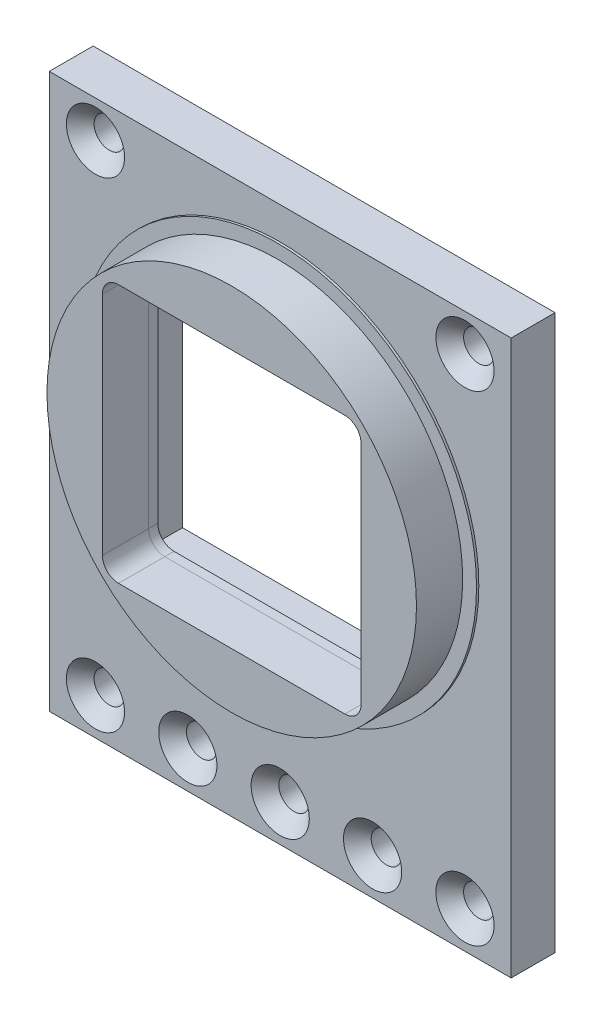
from build123d import *

# Parameters (mm, degrees)
ESQUISSE1_W                                 = 100
ESQUISSE1_H                                 = 100
ESQUISSE1_W_2                               = 56
ESQUISSE1_H_2                               = 56
BOSS_EXTRU_1_DEPTH                          = 10
CONG_1_R                                    = 3.5
BOSS_EXTRU_2_START                          = 10
ESQUISSE3_R                                 = 40
BOSS_EXTRU_2_DEPTH                          = 10
ESQUISSE4_OUTSIDE_W                         = 130.566
ESQUISSE4_OUTSIDE_H                         = 130.566
ESQUISSE4_OUTSIDE_R                         = 43
ENL_V_MAT_EXTRU_2_DEPTH                     = 0.5
ESQUISSE5_W                                 = 61.3
ESQUISSE5_H                                 = 61.3
ENL_V_MAT_EXTRU_3_DEPTH                     = 9
ESQUISSE6_W                                 = 61.3
ESQUISSE6_H                                 = 61.3
BOSS_EXTRU_3_DEPTH                          = 1
ESQUISSE12_W                                = 100
ESQUISSE12_H                                = 9.5
BOSS_EXTRU_5_DEPTH                          = 20
FRAISAGE_POUR_VIS_T_TE_FRAIS_E_M61_AT_COUNT = 2
FRAISAGE_POUR_VIS_T_TE_FRAIS_E_M61_AT_PITCH = 20
FRAISAGE_POUR_VIS_T_TE_FRAIS_E_M61_2_COUNT  = 2
FRAISAGE_POUR_VIS_T_TE_FRAIS_E_M61_2_PITCH  = 40
FRAISAGE_POUR_VIS_T_TE_FRAIS_E_M61_3_COUNT  = 2
FRAISAGE_POUR_VIS_T_TE_FRAIS_E_M61_3_PITCH  = 60
FRAISAGE_POUR_VIS_T_TE_FRAIS_E_M61_4_COUNT  = 2
FRAISAGE_POUR_VIS_T_TE_FRAIS_E_M61_4_PITCH  = 80
FRAISAGE_POUR_VIS_T_TE_FRAIS_E_M61_5_COUNT  = 2
FRAISAGE_POUR_VIS_T_TE_FRAIS_E_M61_5_PITCH  = 104
FRAISAGE_POUR_VIS_T_TE_FRAIS_E_M61_6_COUNT  = 2
FRAISAGE_POUR_VIS_T_TE_FRAIS_E_M61_6_PITCH  = 131.209755735


with BuildPart() as part:
    # Esquisse1 → Boss.-Extru.1 (new body)
    with BuildSketch(Plane.XY):
        Rectangle(ESQUISSE1_W, ESQUISSE1_H)
        Rectangle(ESQUISSE1_W_2, ESQUISSE1_H_2, mode=Mode.SUBTRACT)
    extrude(amount=BOSS_EXTRU_1_DEPTH)

    # Congé1
    cong_1_edges = [part.edges().sort_by_distance(p)[0] for p in [
        (-28, -28, 5),
        (28, 28, 5),
        (-28, 28, 5),
        (28, -28, 5),
    ]]
    fillet(cong_1_edges, radius=CONG_1_R)

    # Esquisse4 outside → Enlèv. mat.-Extru.2 (cut)
    with BuildSketch(Plane.XY.offset(10)):
        Rectangle(ESQUISSE4_OUTSIDE_W, ESQUISSE4_OUTSIDE_H)
        Circle(ESQUISSE4_OUTSIDE_R, mode=Mode.SUBTRACT)
    extrude(amount=-ENL_V_MAT_EXTRU_2_DEPTH, mode=Mode.SUBTRACT)

    # Esquisse5 → Enlèv. mat.-Extru.3 (cut)
    with BuildSketch(Plane(origin=(0, 0, 0), x_dir=(-1, 0, 0), z_dir=(0, 0, -1))):
        Rectangle(ESQUISSE5_W, ESQUISSE5_H)
    extrude(amount=-ENL_V_MAT_EXTRU_3_DEPTH, mode=Mode.SUBTRACT)

    # Esquisse6 → Boss.-Extru.3 (add)
    with BuildSketch(Plane(origin=(0, 0, 9), x_dir=(-1, 0, 0), z_dir=(0, 0, -1))):
        Rectangle(ESQUISSE6_W, ESQUISSE6_H)
        with BuildLine():
            Line((28, -24.5), (28, 24.5))
            ThreePointArc((28, 24.5), (26.974873734, 26.974873734), (24.5, 28))
            Line((24.5, 28), (-24.5, 28))
            ThreePointArc((-24.5, 28), (-26.974873734, 26.974873734), (-28, 24.5))
            Line((-28, 24.5), (-28, -24.5))
            ThreePointArc((-28, -24.5), (-26.974873734, -26.974873734), (-24.5, -28))
            Line((-24.5, -28), (24.5, -28))
            ThreePointArc((24.5, -28), (26.974873734, -26.974873734), (28, -24.5))
        make_face(mode=Mode.SUBTRACT)
    extrude(amount=BOSS_EXTRU_3_DEPTH)

    # Esquisse12 → Boss.-Extru.5 (add)
    with BuildSketch(Plane.XZ.offset(50)):
        with Locations((0, 4.75)):
            Rectangle(ESQUISSE12_W, ESQUISSE12_H)
    extrude(amount=BOSS_EXTRU_5_DEPTH)

    # Esquisse14 → Fraisage pour vis à tête fraisée M61 (revolve, cut)
    with BuildSketch(Plane(origin=(-40, -62, 9.5), x_dir=(0, -1, 0), z_dir=(1, 0, 0))):
        Polygon((0, 0), (0, 9.5), (3.3, 9.5), (3.3, 3), (6.3, 0), align=None)
    fraisage_pour_vis_t_te_frais_e_m61 = revolve(axis=Axis((-40, -62, 15.85), (0, 0, -1)), mode=Mode.SUBTRACT)

    # Fraisage pour vis à tête fraisée M61 at: Fraisage pour vis à tête fraisée M61 ×2
    with Locations(*[(i * FRAISAGE_POUR_VIS_T_TE_FRAIS_E_M61_AT_PITCH, 0, 0) for i in range(1, FRAISAGE_POUR_VIS_T_TE_FRAIS_E_M61_AT_COUNT)]):
        add(fraisage_pour_vis_t_te_frais_e_m61, mode=Mode.SUBTRACT)

    # Fraisage pour vis _ t_te frais_e M61 2: Fraisage pour vis à tête fraisée M61 ×2
    with Locations(*[(i * FRAISAGE_POUR_VIS_T_TE_FRAIS_E_M61_2_PITCH, 0, 0) for i in range(1, FRAISAGE_POUR_VIS_T_TE_FRAIS_E_M61_2_COUNT)]):
        add(fraisage_pour_vis_t_te_frais_e_m61, mode=Mode.SUBTRACT)

    # Fraisage pour vis _ t_te frais_e M61 3: Fraisage pour vis à tête fraisée M61 ×2
    with Locations(*[(i * FRAISAGE_POUR_VIS_T_TE_FRAIS_E_M61_3_PITCH, 0, 0) for i in range(1, FRAISAGE_POUR_VIS_T_TE_FRAIS_E_M61_3_COUNT)]):
        add(fraisage_pour_vis_t_te_frais_e_m61, mode=Mode.SUBTRACT)

    # Fraisage pour vis _ t_te frais_e M61 4: Fraisage pour vis à tête fraisée M61 ×2
    with Locations(*[(i * FRAISAGE_POUR_VIS_T_TE_FRAIS_E_M61_4_PITCH, 0, 0) for i in range(1, FRAISAGE_POUR_VIS_T_TE_FRAIS_E_M61_4_COUNT)]):
        add(fraisage_pour_vis_t_te_frais_e_m61, mode=Mode.SUBTRACT)

    # Fraisage pour vis _ t_te frais_e M61 5: Fraisage pour vis à tête fraisée M61 ×2
    with Locations(*[(0, i * FRAISAGE_POUR_VIS_T_TE_FRAIS_E_M61_5_PITCH, 0) for i in range(1, FRAISAGE_POUR_VIS_T_TE_FRAIS_E_M61_5_COUNT)]):
        add(fraisage_pour_vis_t_te_frais_e_m61, mode=Mode.SUBTRACT)

    # Fraisage pour vis _ t_te frais_e M61 6: Fraisage pour vis à tête fraisée M61 ×2
    with Locations(*[Vector(0.6097107608496922, 0.7926239891046003, 0) * (i * FRAISAGE_POUR_VIS_T_TE_FRAIS_E_M61_6_PITCH) for i in range(1, FRAISAGE_POUR_VIS_T_TE_FRAIS_E_M61_6_COUNT)]):
        add(fraisage_pour_vis_t_te_frais_e_m61, mode=Mode.SUBTRACT)


with BuildPart() as body_2:
    # Esquisse3 → Boss.-Extru.2 (new body)
    with BuildSketch(Plane.XY.offset(10).offset(BOSS_EXTRU_2_START)):
        Circle(ESQUISSE3_R)
        with BuildLine():
            Line((-28, 24.5), (-28, -24.5))
            ThreePointArc((-28, -24.5), (-26.974873734, -26.974873734), (-24.5, -28))
            Line((-24.5, -28), (24.5, -28))
            ThreePointArc((24.5, -28), (26.974873734, -26.974873734), (28, -24.5))
            Line((28, -24.5), (28, 24.5))
            ThreePointArc((28, 24.5), (26.974873734, 26.974873734), (24.5, 28))
            Line((24.5, 28), (-24.5, 28))
            ThreePointArc((-24.5, 28), (-26.974873734, 26.974873734), (-28, 24.5))
        make_face(mode=Mode.SUBTRACT)
    extrude(amount=-BOSS_EXTRU_2_DEPTH)


solid = Compound([part.part, body_2.part])
